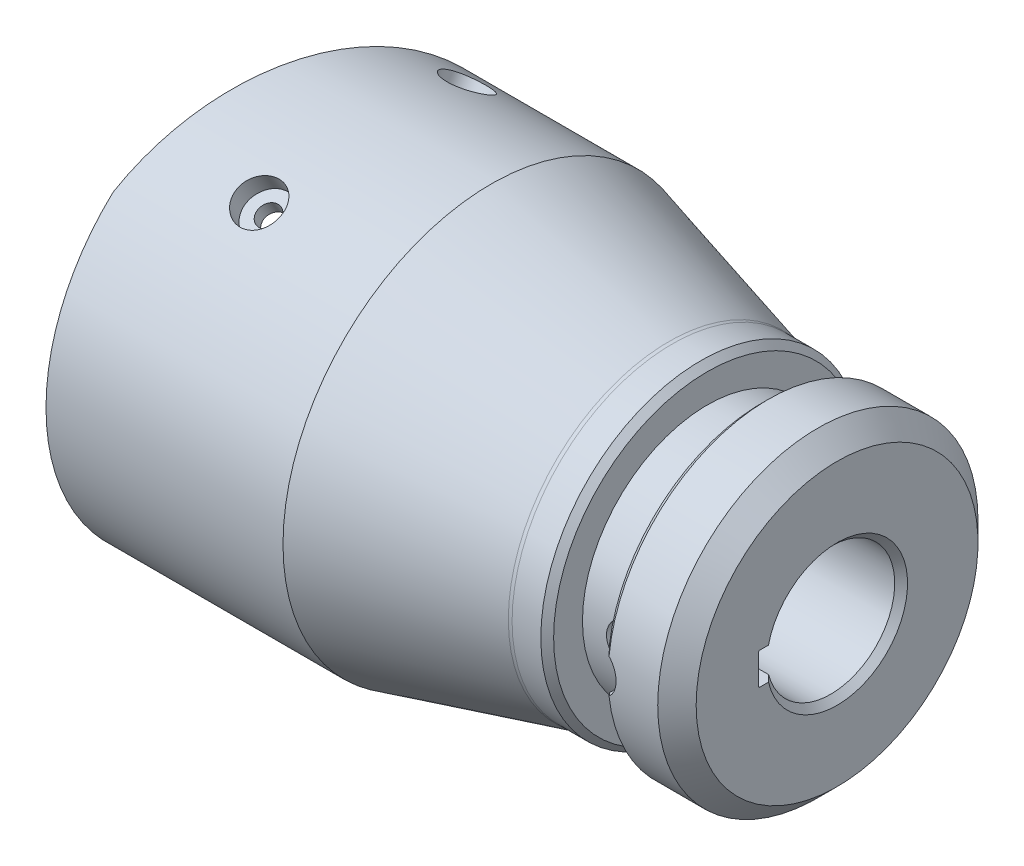
from build123d import *

# Parameters (mm, degrees)
CUT_EXTRUDE_12_DEPTH      = 102.948516419
CUT_EXTRUDE_12_DEPTH_BACK = 102.948516419
CUT_EXTRUDE_START         = 61
CUT_EXTRUDE_5_R0_25_DEPTH = 31


with BuildPart() as part:
    # Эскиз1 → Revolve 244 (revolve)
    with BuildSketch(Plane.XY):
        with BuildLine():
            Line((0, 32.5), (37, 32.5))
            Line((37, 32.5), (64.745695, 25.068113))
            ThreePointArc((64.745695, 25.068113), (65.002224223, 25.017098236), (65.263217049, 24.999995817))
            Line((65.263217049, 24.999995817), (69.749999449, 24.999995817))
            Line((69.749999449, 24.999995817), (70.749999449, 23.999995817))
            Line((70.749999449, 23.999995817), (70.749999449, 19.499995817))
            Line((70.749999449, 19.499995817), (79.25, 19.499995817))
            Line((79.25, 19.499995817), (79.25, 24))
            Line((79.25, 24), (80.25, 25))
            Line((80.25, 25), (88, 25))
            Line((88, 25), (91, 22))
            Line((91, 22), (91, 11))
            Line((91, 11), (90, 10))
            Line((90, 10), (61, 10))
            Line((61, 10), (61, 19))
            ThreePointArc((61, 19), (60.707106781, 19.707106781), (60, 20))
            Line((60, 20), (25, 20))
            Line((25, 20), (25, 27.1))
            ThreePointArc((25, 27.1), (24.882842712, 27.382842712), (24.6, 27.5))
            Line((24.6, 27.5), (0, 27.5))
            Line((0, 27.5), (0, 32.5))
        make_face()
    revolve(axis=Axis((0, 0, 0), (1, 0, 0)))

    # Эскиз2 → Наклон торца 12 градусов (cut, two sides: drawn at the far end of the back side and taken through both)
    with BuildSketch(Plane(origin=(0, 0, 0), x_dir=(1, 0, 0), z_dir=(0, 1, 0)).offset(-CUT_EXTRUDE_12_DEPTH_BACK)):
        Polygon((-25, 50), (15.30407244, 50), (-5.951583727, -50), (-25, -50), align=None)
    extrude(amount=CUT_EXTRUDE_12_DEPTH + CUT_EXTRUDE_12_DEPTH_BACK, mode=Mode.SUBTRACT)

    # Эскиз3 → Паз 5 R0.25 (cut)
    with BuildSketch(Plane(origin=(0, 0, 0), x_dir=(0, 0, -1), z_dir=(1, 0, 0)).offset(CUT_EXTRUDE_START)):
        with BuildLine():
            Line((0, -2.5), (0, 2.5))
            Line((0, 2.5), (-12.05, 2.5))
            ThreePointArc((-12.05, 2.5), (-12.226776695, 2.426776695), (-12.3, 2.25))
            Line((-12.3, 2.25), (-12.3, -2.25))
            ThreePointArc((-12.3, -2.25), (-12.226776695, -2.426776695), (-12.05, -2.5))
            Line((-12.05, -2.5), (0, -2.5))
        make_face()
    extrude(amount=CUT_EXTRUDE_5_R0_25_DEPTH, mode=Mode.SUBTRACT)

    # Эскиз4 → Cut-Revolve M4 30 -1 (revolve, cut)
    with BuildSketch(Plane(origin=(0, 0, 0), x_dir=(1, 0, 0), z_dir=(0, -0.49999999999999994, 0.8660254037844387))):
        Polygon((17, -26), (18.7, -26), (18.7, -29.5), (20.5, -29.5), (20.5, -40), (17, -40), align=None)
    revolve(axis=Axis((17, -17.320508076, -10), (0, -0.8660254037844387, -0.49999999999999994)), mode=Mode.SUBTRACT)

    # Эскиз5 → Cut-Revolve M4 30 1 2 (revolve, cut)
    with BuildSketch(Plane(origin=(0, 0, 0), x_dir=(1, 0, 0), z_dir=(0, -0.49999999999999994, 0.8660254037844387))):
        Polygon((17, 26), (18.7, 26), (18.7, 29.5), (20.5, 29.5), (20.5, 40), (17, 40), align=None)
    revolve(axis=Axis((17, 17.320508076, 10), (0, 0.8660254037844387, 0.49999999999999994)), mode=Mode.SUBTRACT)

    # Эскиз6 → Cut-Revolve M4 150 -1 (revolve, cut)
    with BuildSketch(Plane(origin=(0, 0, 0), x_dir=(1, 0, 0), z_dir=(0, -0.49999999999999994, -0.8660254037844387))):
        Polygon((17, -26), (18.7, -26), (18.7, -29.5), (20.5, -29.5), (20.5, -40), (17, -40), align=None)
    revolve(axis=Axis((17, 17.320508076, -10), (0, 0.8660254037844387, -0.49999999999999994)), mode=Mode.SUBTRACT)

    # Эскиз7 → Cut-Revolve M4 150 1 2 (revolve, cut)
    with BuildSketch(Plane(origin=(0, 0, 0), x_dir=(1, 0, 0), z_dir=(0, -0.49999999999999994, -0.8660254037844387))):
        Polygon((17, 26), (18.7, 26), (18.7, 29.5), (20.5, 29.5), (20.5, 40), (17, 40), align=None)
    revolve(axis=Axis((17, -17.320508076, 10), (0, -0.8660254037844387, 0.49999999999999994)), mode=Mode.SUBTRACT)

    # Эскиз8 → Радиальное отверстие 3.6 цековка 7 (revolve, cut)
    with BuildSketch(Plane(origin=(0, 0, 0), x_dir=(1, 0, 0), z_dir=(0, 1, 0))):
        Polygon((78, -8), (79.8, -8), (79.8, -15), (81.5, -15), (81.5, -35), (78, -35), align=None)
    revolve(axis=Axis((78, 0, 0), (0, 0, 1)), mode=Mode.SUBTRACT)


solid = part.part
